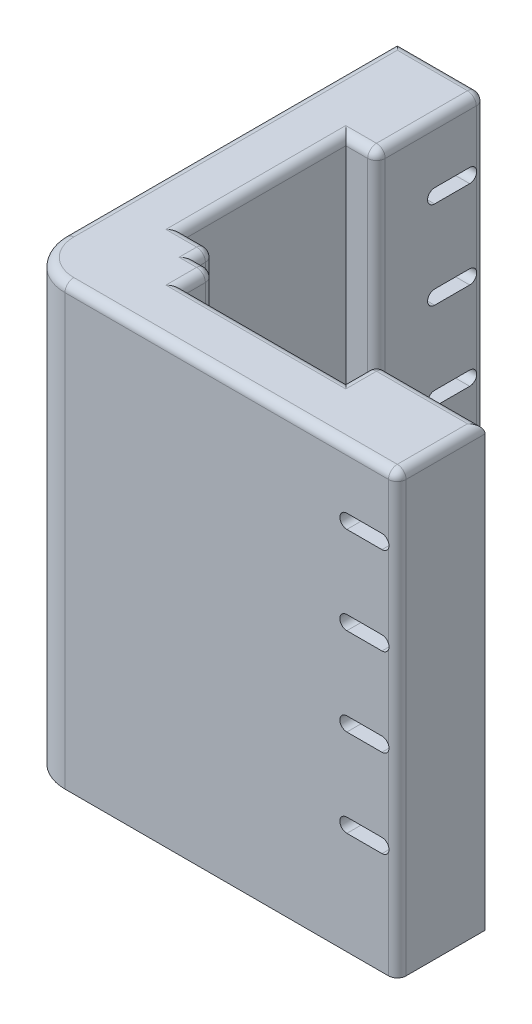
from build123d import *

# Parameters (mm, degrees)
BOSS_EXTRUDE1_DEPTH = 100
SKETCH2_W           = 37
SKETCH2_H           = 112.688383797
CUT_EXTRUDE1_DEPTH  = 7
SKETCH3_W           = 37
SKETCH3_H           = 114.700676364
CUT_EXTRUDE2_DEPTH  = 7
CUT_EXTRUDE3_DEPTH  = 148.228139294
CUT_EXTRUDE4_DEPTH  = 137.550814717
FILLET1_R           = 10
FILLET2_R           = 2
FILLET3_R           = 2
FILLET4_R           = 2


with BuildPart() as part:
    # Sketch1 → Boss-Extrude1 (new body)
    with BuildSketch(Plane(origin=(0, 0, 0), x_dir=(1, 0, 0), z_dir=(0, 1, 0))):
        Polygon((0, 0), (65.75, 0), (65.75, -20), (-20, -20), (-20, 65.75), (0, 65.75), align=None)
    extrude(amount=BOSS_EXTRUDE1_DEPTH)

    # Sketch2 → Cut-Extrude1 (cut)
    with BuildSketch(Plane(origin=(0, 0, 0), x_dir=(0, 0, -1), z_dir=(1, 0, 0))):
        with Locations((22.5, 52.54890392)):
            Rectangle(SKETCH2_W, SKETCH2_H)
    extrude(amount=-CUT_EXTRUDE1_DEPTH, mode=Mode.SUBTRACT)

    # Sketch3 → Cut-Extrude2 (cut)
    with BuildSketch(Plane(origin=(0, 0, 0), x_dir=(-1, 0, 0), z_dir=(0, 0, -1))):
        with Locations((-22.5, 48.993853716)):
            Rectangle(SKETCH3_W, SKETCH3_H)
    extrude(amount=-CUT_EXTRUDE2_DEPTH, mode=Mode.SUBTRACT)

    # Sketch4 → Cut-Extrude3 (cut, through all)
    with BuildSketch(Plane.ZY.offset(20)):
        with BuildLine():
            Line((-62.25, 86.6), (-54.25, 86.6))
            ThreePointArc((-54.25, 86.6), (-52.65, 85), (-54.25, 83.4))
            Line((-54.25, 83.4), (-62.25, 83.4))
            ThreePointArc((-62.25, 83.4), (-63.85, 85), (-62.25, 86.6))
        make_face()
        with BuildLine():
            Line((-62.25, 66.6), (-54.25, 66.6))
            ThreePointArc((-54.25, 66.6), (-52.65, 65), (-54.25, 63.4))
            Line((-54.25, 63.4), (-62.25, 63.4))
            ThreePointArc((-62.25, 63.4), (-63.85, 65), (-62.25, 66.6))
        make_face()
        with BuildLine():
            Line((-62.25, 46.6), (-54.25, 46.6))
            ThreePointArc((-54.25, 46.6), (-52.65, 45), (-54.25, 43.4))
            Line((-54.25, 43.4), (-62.25, 43.4))
            ThreePointArc((-62.25, 43.4), (-63.85, 45), (-62.25, 46.6))
        make_face()
        with BuildLine():
            Line((-62.25, 26.6), (-54.25, 26.6))
            ThreePointArc((-54.25, 26.6), (-52.65, 25), (-54.25, 23.4))
            Line((-54.25, 23.4), (-62.25, 23.4))
            ThreePointArc((-62.25, 23.4), (-63.85, 25), (-62.25, 26.6))
        make_face()
    extrude(amount=-CUT_EXTRUDE3_DEPTH, mode=Mode.SUBTRACT)

    # Sketch6 → Cut-Extrude4 (cut, through all)
    with BuildSketch(Plane(origin=(0, 0, 0), x_dir=(-1, 0, 0), z_dir=(0, 0, -1))):
        with BuildLine():
            Line((-62.25, 86.6), (-54.25, 86.6))
            ThreePointArc((-54.25, 86.6), (-52.65, 85), (-54.25, 83.4))
            Line((-54.25, 83.4), (-62.25, 83.4))
            ThreePointArc((-62.25, 83.4), (-63.85, 85), (-62.25, 86.6))
        make_face()
        with BuildLine():
            Line((-62.25, 66.6), (-54.25, 66.6))
            ThreePointArc((-54.25, 66.6), (-52.65, 65), (-54.25, 63.4))
            Line((-54.25, 63.4), (-62.25, 63.4))
            ThreePointArc((-62.25, 63.4), (-63.85, 65), (-62.25, 66.6))
        make_face()
        with BuildLine():
            Line((-62.25, 46.6), (-54.25, 46.6))
            ThreePointArc((-54.25, 46.6), (-52.65, 45), (-54.25, 43.4))
            Line((-54.25, 43.4), (-62.25, 43.4))
            ThreePointArc((-62.25, 43.4), (-63.85, 45), (-62.25, 46.6))
        make_face()
        with BuildLine():
            Line((-62.25, 26.6), (-54.25, 26.6))
            ThreePointArc((-54.25, 26.6), (-52.65, 25), (-54.25, 23.4))
            Line((-54.25, 23.4), (-62.25, 23.4))
            ThreePointArc((-62.25, 23.4), (-63.85, 25), (-62.25, 26.6))
        make_face()
    extrude(amount=-CUT_EXTRUDE4_DEPTH, mode=Mode.SUBTRACT)

    # Fillet1
    fillet1_edges = [part.edges().sort_by_distance(p)[0] for p in [
        (-20, 50, 20),
    ]]
    fillet(fillet1_edges, radius=FILLET1_R)

    # Fillet2
    fillet2_edges = [part.edges().sort_by_distance(p)[0] for p in [
        (0, 50, -41),
        (0, 50, -4),
        (4, 50, 0),
        (41, 50, 0),
    ]]
    fillet(fillet2_edges, radius=FILLET2_R)

    # Fillet3
    fillet3_edges = [part.edges().sort_by_distance(p)[0] for p in [
        (-20, 100, -27.875),
        (65.75, 100, 10),
        (27.875, 100, 20),
        (-17.071067812, 100, 17.071067812),
        (4, 100, 4.5),
        (1, 100, 0),
        (-4.5, 100, -41),
        (0, 100, -54.375),
        (-0.585786438, 100, -3.414213562),
        (-0.585786438, 100, -41.585786438),
        (3.414213562, 100, 0.585786438),
        (41.585786438, 100, 0.585786438),
        (54.375, 100, 0),
        (-4.5, 100, -4),
        (-7, 100, -22.5),
        (0, 100, -1),
        (41, 100, 4.5),
        (22.5, 100, 7),
        (-10, 100, -65.75),
    ]]
    fillet(fillet3_edges, radius=FILLET3_R)

    # Fillet4
    # the kernel refuses this fillet: 2 mm, written as the material it takes off along each edge
    with BuildSketch(Plane(origin=(-2, 98, -63.75), x_dir=(0, 0, -1), z_dir=(1, 0, 0))) as fillet4_piece_1_section:
        Polygon((0, 0), (FILLET4_R, 0), (FILLET4_R, FILLET4_R), (0, FILLET4_R), align=None)
    fillet4_piece_1 = extrude(amount=FILLET4_R, mode=Mode.PRIVATE)
    fillet4_piece_1 = fillet4_piece_1 - Plane(origin=(-2, 98, -63.75), x_dir=(0, -0.7071067811865475, 0.7071067811865475), z_dir=(1, 0, 0)) * Sphere(FILLET4_R, mode=Mode.PRIVATE)
    add(fillet4_piece_1, mode=Mode.SUBTRACT)
    with BuildSketch(Plane(origin=(63.75, 98, 18), x_dir=(1, 0, 0), z_dir=(0, 0, 1))) as fillet4_piece_2_section:
        Polygon((0, 0), (FILLET4_R, 0), (FILLET4_R, FILLET4_R), (0, FILLET4_R), align=None)
    fillet4_piece_2 = extrude(amount=FILLET4_R, mode=Mode.PRIVATE)
    fillet4_piece_2 = fillet4_piece_2 - Plane(origin=(63.75, 98, 18), x_dir=(-0.7071067811865475, -0.7071067811865475, 0), z_dir=(0, 0, 1)) * Sphere(FILLET4_R, mode=Mode.PRIVATE)
    add(fillet4_piece_2, mode=Mode.SUBTRACT)
    with BuildSketch(Plane(origin=(65.75, -5, 20), x_dir=(-1, 0, 0), z_dir=(0, 1, 0)), Plane(origin=(0, -5, -65.75), x_dir=(0, 0, 1), z_dir=(0, 1, 0))) as fillet4_piece_3:
        with BuildLine():
            CenterArc((FILLET4_R, -FILLET4_R), FILLET4_R, 90, 90)
            Line((0, -FILLET4_R), (0, 0))
            Line((0, 0), (FILLET4_R, 0))
        make_face()
    extrude(amount=103, mode=Mode.SUBTRACT)


solid = part.part
